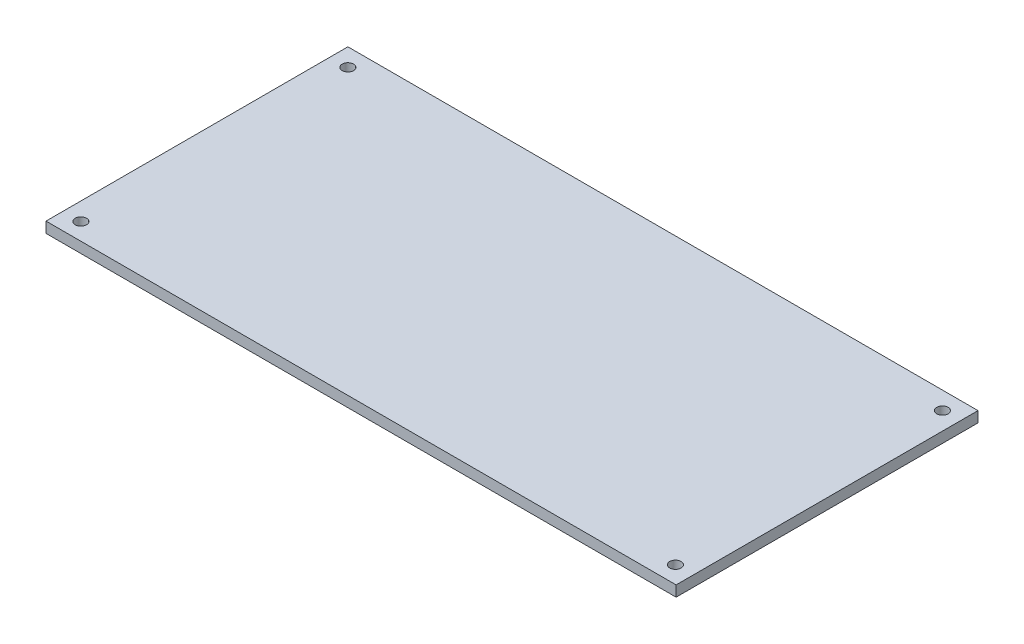
from build123d import *

# Parameters (mm, degrees)
SKETCH1_W           = 177
SKETCH1_H           = 84.8
BOSS_EXTRUDE1_DEPTH = 3
SKETCH2_R           = 1.6
CUT_EXTRUDE1_DEPTH  = 99.178459959


with BuildPart() as part:
    # Sketch1 → Boss-Extrude1 (new body)
    with BuildSketch(Plane(origin=(0, 0, 0), x_dir=(1, 0, 0), z_dir=(0, 1, 0))):
        Rectangle(SKETCH1_W, SKETCH1_H)
    extrude(amount=BOSS_EXTRUDE1_DEPTH)

    # Sketch2 → Cut-Extrude1 (cut, through all)
    with BuildSketch(Plane(origin=(0, 3, 0), x_dir=(1, 0, 0), z_dir=(0, 1, 0))):
        with Locations((83.5, -37.6)):
            Circle(SKETCH2_R)
        with Locations((83.5, 37.4)):
            Circle(SKETCH2_R)
        with Locations((-83.5, 37.4)):
            Circle(SKETCH2_R)
        with Locations((-83.5, -37.6)):
            Circle(SKETCH2_R)
    extrude(amount=-CUT_EXTRUDE1_DEPTH, mode=Mode.SUBTRACT)


solid = part.part
